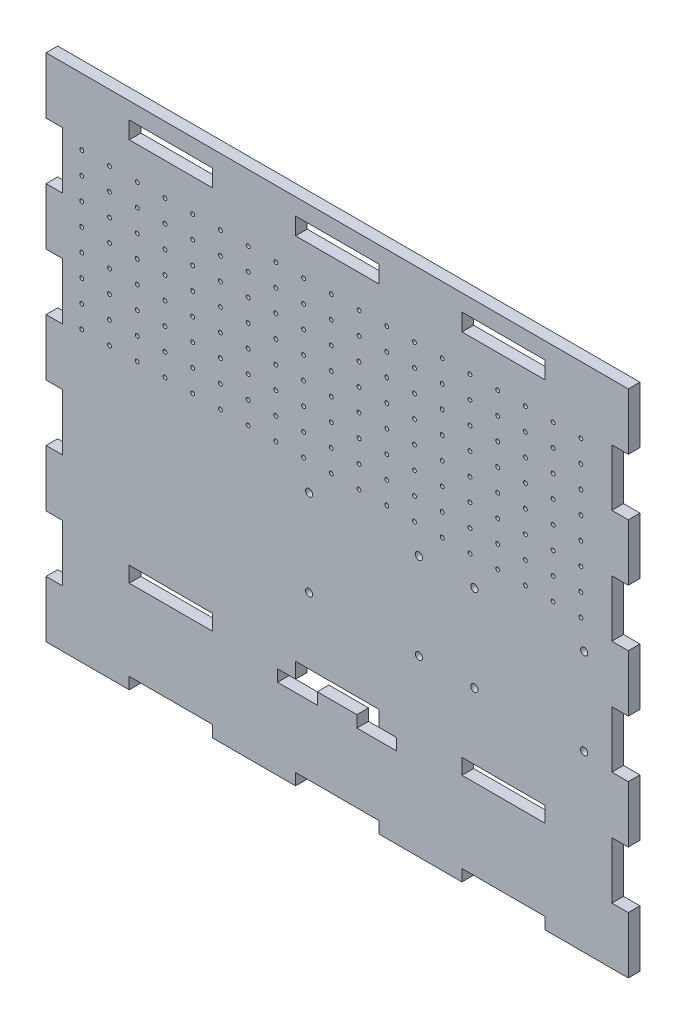
from build123d import *

# Parameters (mm, degrees)
SKETCH1_W                = 266.7
SKETCH1_H                = 223.52
BOSS_EXTRUDE1_DEPTH      = 5.334
SKETCH2_W                = 38.1
SKETCH2_H                = 5.334
CUT_EXTRUDE1_DEPTH       = 197.710659379
SKETCH5_W                = 38.1
SKETCH5_H                = 7.112
CUT_EXTRUDE3_DEPTH       = 197.710659379
SKETCH8_W                = 18.149934459
SKETCH8_H                = 5.334
SKETCH8_W_2              = 18.14993446
CUT_EXTRUDE6_DEPTH       = 197.710659379
SKETCH9_R                = 0.889
CUT_EXTRUDE7_DEPTH       = 197.710659379
SKETCH10_W               = 38.1
SKETCH10_H               = 5.334
BOSS_EXTRUDE2_DEPTH      = 10.16
BOSS_EXTRUDE3_DEPTH      = 76.2
BOSS_EXTRUDE3_DEPTH_BACK = 190.5
SKETCH12_W               = 5.334
SKETCH12_H               = 7.62
SKETCH13_W               = 38.1
SKETCH13_H               = 5.334
BOSS_EXTRUDE4_DEPTH      = 2.54
SKETCH14_W               = 38.1
SKETCH14_H               = 5.334
BOSS_EXTRUDE5_DEPTH      = 2.54
SKETCH15_W               = 38.1
SKETCH15_H               = 5.334
BOSS_EXTRUDE6_DEPTH      = 2.54
SKETCH16_W               = 7.526133844
SKETCH16_H               = 25.964444445
SKETCH16_H_2             = 25.964444444
SKETCH16_W_2             = 7.526133845
CUT_EXTRUDE9_DEPTH       = 205.029793122
SKETCH17_R               = 1.651
CUT_EXTRUDE10_DEPTH      = 205.029793122


with BuildPart() as part:
    # Sketch1 → Boss-Extrude1 (new body)
    with BuildSketch(Plane.XY):
        with Locations((5.474099752, 27.504142138)):
            Rectangle(SKETCH1_W, SKETCH1_H)
    extrude(amount=BOSS_EXTRUDE1_DEPTH)

    # Sketch2 → Cut-Extrude1 (cut, through all)
    with BuildSketch(Plane.XY.offset(5.334)):
        with Locations((-70.725900248, -81.588857862)):
            Rectangle(SKETCH2_W, SKETCH2_H)
        with Locations((5.474099752, -81.588857862)):
            Rectangle(SKETCH2_W, SKETCH2_H)
        with Locations((81.674099752, -81.588857862)):
            Rectangle(SKETCH2_W, SKETCH2_H)
        with Locations((81.674099752, 136.597142138)):
            Rectangle(SKETCH2_W, SKETCH2_H)
        with Locations((5.474099752, 136.597142138)):
            Rectangle(SKETCH2_W, SKETCH2_H)
        with Locations((-70.725900248, 136.597142138)):
            Rectangle(SKETCH2_W, SKETCH2_H)
    extrude(amount=-CUT_EXTRUDE1_DEPTH, mode=Mode.SUBTRACT)

    # Sketch5 → Cut-Extrude3 (cut, through all)
    with BuildSketch(Plane.XY.offset(5.334)):
        with Locations((-70.725900248, -38.378413173)):
            Rectangle(SKETCH5_W, SKETCH5_H)
        with Locations((5.474099752, -38.378413173)):
            Rectangle(SKETCH5_W, SKETCH5_H)
        with Locations((81.674099752, -38.378413173)):
            Rectangle(SKETCH5_W, SKETCH5_H)
    extrude(amount=-CUT_EXTRUDE3_DEPTH, mode=Mode.SUBTRACT)

    # Sketch8 → Cut-Extrude6 (cut, through all)
    with BuildSketch(Plane.XY.offset(5.334)):
        with Locations((-12.722736397, -44.601413173)):
            Rectangle(SKETCH8_W, SKETCH8_H)
        with Locations((23.577132522, -44.601413173)):
            Rectangle(SKETCH8_W_2, SKETCH8_H)
    extrude(amount=-CUT_EXTRUDE6_DEPTH, mode=Mode.SUBTRACT)

    # Sketch9 → Cut-Extrude7 (cut, through all)
    with BuildSketch(Plane.XY.offset(5.334)):
        with Locations((-111.514346632, 118.978930244)):
            Circle(SKETCH9_R)
        with Locations((-98.814346632, 118.978930244)):
            Circle(SKETCH9_R)
        with Locations((-86.114346632, 118.978930244)):
            Circle(SKETCH9_R)
        with Locations((-73.414346632, 118.978930244)):
            Circle(SKETCH9_R)
        with Locations((-60.714346632, 118.978930244)):
            Circle(SKETCH9_R)
        with Locations((-48.014346632, 118.978930244)):
            Circle(SKETCH9_R)
        with Locations((-35.314346632, 118.978930244)):
            Circle(SKETCH9_R)
        with Locations((-22.614346632, 118.978930244)):
            Circle(SKETCH9_R)
        with Locations((-9.914346632, 118.978930244)):
            Circle(SKETCH9_R)
        with Locations((2.785653368, 118.978930244)):
            Circle(SKETCH9_R)
        with Locations((15.485653368, 118.978930244)):
            Circle(SKETCH9_R)
        with Locations((28.185653368, 118.978930244)):
            Circle(SKETCH9_R)
        with Locations((40.885653368, 118.978930244)):
            Circle(SKETCH9_R)
        with Locations((53.585653368, 118.978930244)):
            Circle(SKETCH9_R)
        with Locations((66.285653368, 118.978930244)):
            Circle(SKETCH9_R)
        with Locations((78.985653368, 118.978930244)):
            Circle(SKETCH9_R)
        with Locations((91.685653368, 118.978930244)):
            Circle(SKETCH9_R)
        with Locations((104.385653368, 118.978930244)):
            Circle(SKETCH9_R)
        with Locations((117.085653368, 118.978930244)):
            Circle(SKETCH9_R)
        with Locations((-111.514346632, 108.818930244)):
            Circle(SKETCH9_R)
        with Locations((-98.814346632, 108.818930244)):
            Circle(SKETCH9_R)
        with Locations((-86.114346632, 108.818930244)):
            Circle(SKETCH9_R)
        with Locations((-73.414346632, 108.818930244)):
            Circle(SKETCH9_R)
        with Locations((-60.714346632, 108.818930244)):
            Circle(SKETCH9_R)
        with Locations((-48.014346632, 108.818930244)):
            Circle(SKETCH9_R)
        with Locations((-35.314346632, 108.818930244)):
            Circle(SKETCH9_R)
        with Locations((-22.614346632, 108.818930244)):
            Circle(SKETCH9_R)
        with Locations((-9.914346632, 108.818930244)):
            Circle(SKETCH9_R)
        with Locations((2.785653368, 108.818930244)):
            Circle(SKETCH9_R)
        with Locations((15.485653368, 108.818930244)):
            Circle(SKETCH9_R)
        with Locations((28.185653368, 108.818930244)):
            Circle(SKETCH9_R)
        with Locations((40.885653368, 108.818930244)):
            Circle(SKETCH9_R)
        with Locations((53.585653368, 108.818930244)):
            Circle(SKETCH9_R)
        with Locations((66.285653368, 108.818930244)):
            Circle(SKETCH9_R)
        with Locations((78.985653368, 108.818930244)):
            Circle(SKETCH9_R)
        with Locations((91.685653368, 108.818930244)):
            Circle(SKETCH9_R)
        with Locations((104.385653368, 108.818930244)):
            Circle(SKETCH9_R)
        with Locations((117.085653368, 108.818930244)):
            Circle(SKETCH9_R)
        with Locations((-111.514346632, 98.658930244)):
            Circle(SKETCH9_R)
        with Locations((-98.814346632, 98.658930244)):
            Circle(SKETCH9_R)
        with Locations((-86.114346632, 98.658930244)):
            Circle(SKETCH9_R)
        with Locations((-73.414346632, 98.658930244)):
            Circle(SKETCH9_R)
        with Locations((-60.714346632, 98.658930244)):
            Circle(SKETCH9_R)
        with Locations((-48.014346632, 98.658930244)):
            Circle(SKETCH9_R)
        with Locations((-35.314346632, 98.658930244)):
            Circle(SKETCH9_R)
        with Locations((-22.614346632, 98.658930244)):
            Circle(SKETCH9_R)
        with Locations((-9.914346632, 98.658930244)):
            Circle(SKETCH9_R)
        with Locations((2.785653368, 98.658930244)):
            Circle(SKETCH9_R)
        with Locations((15.485653368, 98.658930244)):
            Circle(SKETCH9_R)
        with Locations((28.185653368, 98.658930244)):
            Circle(SKETCH9_R)
        with Locations((40.885653368, 98.658930244)):
            Circle(SKETCH9_R)
        with Locations((53.585653368, 98.658930244)):
            Circle(SKETCH9_R)
        with Locations((66.285653368, 98.658930244)):
            Circle(SKETCH9_R)
        with Locations((78.985653368, 98.658930244)):
            Circle(SKETCH9_R)
        with Locations((91.685653368, 98.658930244)):
            Circle(SKETCH9_R)
        with Locations((104.385653368, 98.658930244)):
            Circle(SKETCH9_R)
        with Locations((117.085653368, 98.658930244)):
            Circle(SKETCH9_R)
        with Locations((-111.514346632, 88.498930244)):
            Circle(SKETCH9_R)
        with Locations((-98.814346632, 88.498930244)):
            Circle(SKETCH9_R)
        with Locations((-86.114346632, 88.498930244)):
            Circle(SKETCH9_R)
        with Locations((-73.414346632, 88.498930244)):
            Circle(SKETCH9_R)
        with Locations((-60.714346632, 88.498930244)):
            Circle(SKETCH9_R)
        with Locations((-48.014346632, 88.498930244)):
            Circle(SKETCH9_R)
        with Locations((-35.314346632, 88.498930244)):
            Circle(SKETCH9_R)
        with Locations((-22.614346632, 88.498930244)):
            Circle(SKETCH9_R)
        with Locations((-9.914346632, 88.498930244)):
            Circle(SKETCH9_R)
        with Locations((2.785653368, 88.498930244)):
            Circle(SKETCH9_R)
        with Locations((15.485653368, 88.498930244)):
            Circle(SKETCH9_R)
        with Locations((28.185653368, 88.498930244)):
            Circle(SKETCH9_R)
        with Locations((40.885653368, 88.498930244)):
            Circle(SKETCH9_R)
        with Locations((53.585653368, 88.498930244)):
            Circle(SKETCH9_R)
        with Locations((66.285653368, 88.498930244)):
            Circle(SKETCH9_R)
        with Locations((78.985653368, 88.498930244)):
            Circle(SKETCH9_R)
        with Locations((91.685653368, 88.498930244)):
            Circle(SKETCH9_R)
        with Locations((104.385653368, 88.498930244)):
            Circle(SKETCH9_R)
        with Locations((117.085653368, 88.498930244)):
            Circle(SKETCH9_R)
        with Locations((-111.514346632, 78.338930244)):
            Circle(SKETCH9_R)
        with Locations((-98.814346632, 78.338930244)):
            Circle(SKETCH9_R)
        with Locations((-86.114346632, 78.338930244)):
            Circle(SKETCH9_R)
        with Locations((-73.414346632, 78.338930244)):
            Circle(SKETCH9_R)
        with Locations((-60.714346632, 78.338930244)):
            Circle(SKETCH9_R)
        with Locations((-48.014346632, 78.338930244)):
            Circle(SKETCH9_R)
        with Locations((-35.314346632, 78.338930244)):
            Circle(SKETCH9_R)
        with Locations((-22.614346632, 78.338930244)):
            Circle(SKETCH9_R)
        with Locations((-9.914346632, 78.338930244)):
            Circle(SKETCH9_R)
        with Locations((2.785653368, 78.338930244)):
            Circle(SKETCH9_R)
        with Locations((15.485653368, 78.338930244)):
            Circle(SKETCH9_R)
        with Locations((28.185653368, 78.338930244)):
            Circle(SKETCH9_R)
        with Locations((40.885653368, 78.338930244)):
            Circle(SKETCH9_R)
        with Locations((53.585653368, 78.338930244)):
            Circle(SKETCH9_R)
        with Locations((66.285653368, 78.338930244)):
            Circle(SKETCH9_R)
        with Locations((78.985653368, 78.338930244)):
            Circle(SKETCH9_R)
        with Locations((91.685653368, 78.338930244)):
            Circle(SKETCH9_R)
        with Locations((104.385653368, 78.338930244)):
            Circle(SKETCH9_R)
        with Locations((117.085653368, 78.338930244)):
            Circle(SKETCH9_R)
        with Locations((-111.514346632, 68.178930244)):
            Circle(SKETCH9_R)
        with Locations((-98.814346632, 68.178930244)):
            Circle(SKETCH9_R)
        with Locations((-86.114346632, 68.178930244)):
            Circle(SKETCH9_R)
        with Locations((-73.414346632, 68.178930244)):
            Circle(SKETCH9_R)
        with Locations((-60.714346632, 68.178930244)):
            Circle(SKETCH9_R)
        with Locations((-48.014346632, 68.178930244)):
            Circle(SKETCH9_R)
        with Locations((-35.314346632, 68.178930244)):
            Circle(SKETCH9_R)
        with Locations((-22.614346632, 68.178930244)):
            Circle(SKETCH9_R)
        with Locations((-9.914346632, 68.178930244)):
            Circle(SKETCH9_R)
        with Locations((2.785653368, 68.178930244)):
            Circle(SKETCH9_R)
        with Locations((15.485653368, 68.178930244)):
            Circle(SKETCH9_R)
        with Locations((28.185653368, 68.178930244)):
            Circle(SKETCH9_R)
        with Locations((40.885653368, 68.178930244)):
            Circle(SKETCH9_R)
        with Locations((53.585653368, 68.178930244)):
            Circle(SKETCH9_R)
        with Locations((66.285653368, 68.178930244)):
            Circle(SKETCH9_R)
        with Locations((78.985653368, 68.178930244)):
            Circle(SKETCH9_R)
        with Locations((91.685653368, 68.178930244)):
            Circle(SKETCH9_R)
        with Locations((104.385653368, 68.178930244)):
            Circle(SKETCH9_R)
        with Locations((117.085653368, 68.178930244)):
            Circle(SKETCH9_R)
        with Locations((-111.514346632, 58.018930244)):
            Circle(SKETCH9_R)
        with Locations((-98.814346632, 58.018930244)):
            Circle(SKETCH9_R)
        with Locations((-86.114346632, 58.018930244)):
            Circle(SKETCH9_R)
        with Locations((-73.414346632, 58.018930244)):
            Circle(SKETCH9_R)
        with Locations((-60.714346632, 58.018930244)):
            Circle(SKETCH9_R)
        with Locations((-48.014346632, 58.018930244)):
            Circle(SKETCH9_R)
        with Locations((-35.314346632, 58.018930244)):
            Circle(SKETCH9_R)
        with Locations((-22.614346632, 58.018930244)):
            Circle(SKETCH9_R)
        with Locations((-9.914346632, 58.018930244)):
            Circle(SKETCH9_R)
        with Locations((2.785653368, 58.018930244)):
            Circle(SKETCH9_R)
        with Locations((15.485653368, 58.018930244)):
            Circle(SKETCH9_R)
        with Locations((28.185653368, 58.018930244)):
            Circle(SKETCH9_R)
        with Locations((40.885653368, 58.018930244)):
            Circle(SKETCH9_R)
        with Locations((53.585653368, 58.018930244)):
            Circle(SKETCH9_R)
        with Locations((66.285653368, 58.018930244)):
            Circle(SKETCH9_R)
        with Locations((78.985653368, 58.018930244)):
            Circle(SKETCH9_R)
        with Locations((91.685653368, 58.018930244)):
            Circle(SKETCH9_R)
        with Locations((104.385653368, 58.018930244)):
            Circle(SKETCH9_R)
        with Locations((117.085653368, 58.018930244)):
            Circle(SKETCH9_R)
        with Locations((-111.514346632, 47.858930244)):
            Circle(SKETCH9_R)
        with Locations((-98.814346632, 47.858930244)):
            Circle(SKETCH9_R)
        with Locations((-86.114346632, 47.858930244)):
            Circle(SKETCH9_R)
        with Locations((-73.414346632, 47.858930244)):
            Circle(SKETCH9_R)
        with Locations((-60.714346632, 47.858930244)):
            Circle(SKETCH9_R)
        with Locations((-48.014346632, 47.858930244)):
            Circle(SKETCH9_R)
        with Locations((-35.314346632, 47.858930244)):
            Circle(SKETCH9_R)
        with Locations((-22.614346632, 47.858930244)):
            Circle(SKETCH9_R)
        with Locations((-9.914346632, 47.858930244)):
            Circle(SKETCH9_R)
        with Locations((2.785653368, 47.858930244)):
            Circle(SKETCH9_R)
        with Locations((15.485653368, 47.858930244)):
            Circle(SKETCH9_R)
        with Locations((28.185653368, 47.858930244)):
            Circle(SKETCH9_R)
        with Locations((40.885653368, 47.858930244)):
            Circle(SKETCH9_R)
        with Locations((53.585653368, 47.858930244)):
            Circle(SKETCH9_R)
        with Locations((66.285653368, 47.858930244)):
            Circle(SKETCH9_R)
        with Locations((78.985653368, 47.858930244)):
            Circle(SKETCH9_R)
        with Locations((91.685653368, 47.858930244)):
            Circle(SKETCH9_R)
        with Locations((104.385653368, 47.858930244)):
            Circle(SKETCH9_R)
        with Locations((117.085653368, 47.858930244)):
            Circle(SKETCH9_R)
    extrude(amount=-CUT_EXTRUDE7_DEPTH, mode=Mode.SUBTRACT)

    # Sketch10 → Boss-Extrude2 (add)
    with BuildSketch(Plane(origin=(0, 139.264142138, 0), x_dir=(1, 0, 0), z_dir=(0, 1, 0))):
        with Locations((-32.625900248, -2.667)):
            Rectangle(SKETCH10_W, SKETCH10_H)
    extrude(amount=BOSS_EXTRUDE2_DEPTH)

    # Sketch12 → Boss-Extrude3 (add, two sides: drawn at the far end of the back side and taken through both)
    with BuildSketch(Plane.ZY.offset(51.675900248).offset(-BOSS_EXTRUDE3_DEPTH_BACK)):
        with Locations((2.667, 145.614142138)):
            Rectangle(SKETCH12_W, SKETCH12_H)
    extrude(amount=BOSS_EXTRUDE3_DEPTH + BOSS_EXTRUDE3_DEPTH_BACK)

    # Sketch13 → Boss-Extrude4 (add)
    with BuildSketch(Plane(origin=(0, 139.264142138, 0), x_dir=(1, 0, 0), z_dir=(0, 1, 0))):
        with Locations((-108.825900248, -2.667)):
            Rectangle(SKETCH13_W, SKETCH13_H)
    extrude(amount=BOSS_EXTRUDE4_DEPTH)

    # Sketch14 → Boss-Extrude5 (add)
    with BuildSketch(Plane(origin=(0, 139.264142138, 0), x_dir=(1, 0, 0), z_dir=(0, 1, 0))):
        with Locations((43.574099752, -2.667)):
            Rectangle(SKETCH14_W, SKETCH14_H)
    extrude(amount=BOSS_EXTRUDE5_DEPTH)

    # Sketch15 → Boss-Extrude6 (add)
    with BuildSketch(Plane(origin=(0, 139.264142138, 0), x_dir=(1, 0, 0), z_dir=(0, 1, 0))):
        with Locations((119.774099752, -2.667)):
            Rectangle(SKETCH15_W, SKETCH15_H)
    extrude(amount=BOSS_EXTRUDE6_DEPTH)

    # Sketch16 → Cut-Extrude9 (cut, through all)
    with BuildSketch(Plane.XY.offset(5.334)):
        with Locations((-124.112833326, -45.309191196)):
            Rectangle(SKETCH16_W, SKETCH16_H)
        with Locations((-124.112833326, 6.619697693)):
            Rectangle(SKETCH16_W, SKETCH16_H)
        with Locations((-124.112833326, 58.548586582)):
            Rectangle(SKETCH16_W, SKETCH16_H_2)
        with Locations((-124.112833326, 110.477475471)):
            Rectangle(SKETCH16_W, SKETCH16_H_2)
        with Locations((135.061032829, 110.477475471)):
            Rectangle(SKETCH16_W_2, SKETCH16_H_2)
        with Locations((135.061032829, 58.548586582)):
            Rectangle(SKETCH16_W_2, SKETCH16_H_2)
        with Locations((135.061032829, 6.619697693)):
            Rectangle(SKETCH16_W_2, SKETCH16_H)
        with Locations((135.061032829, -45.309191196)):
            Rectangle(SKETCH16_W_2, SKETCH16_H)
    extrude(amount=-CUT_EXTRUDE9_DEPTH, mode=Mode.SUBTRACT)

    # Sketch17 → Cut-Extrude10 (cut, through all)
    with BuildSketch(Plane.XY.offset(5.334)):
        with Locations((118.597965907, 35.158930244)):
            Circle(SKETCH17_R)
        with Locations((68.305965907, 35.158930244)):
            Circle(SKETCH17_R)
        with Locations((68.305965907, -4.465069756)):
            Circle(SKETCH17_R)
        with Locations((118.597965907, -4.465069756)):
            Circle(SKETCH17_R)
        with Locations((42.905965907, 35.158930244)):
            Circle(SKETCH17_R)
        with Locations((-7.386034093, 35.158930244)):
            Circle(SKETCH17_R)
        with Locations((-7.386034093, -4.465069756)):
            Circle(SKETCH17_R)
        with Locations((42.905965907, -4.465069756)):
            Circle(SKETCH17_R)
    extrude(amount=-CUT_EXTRUDE10_DEPTH, mode=Mode.SUBTRACT)


solid = part.part
